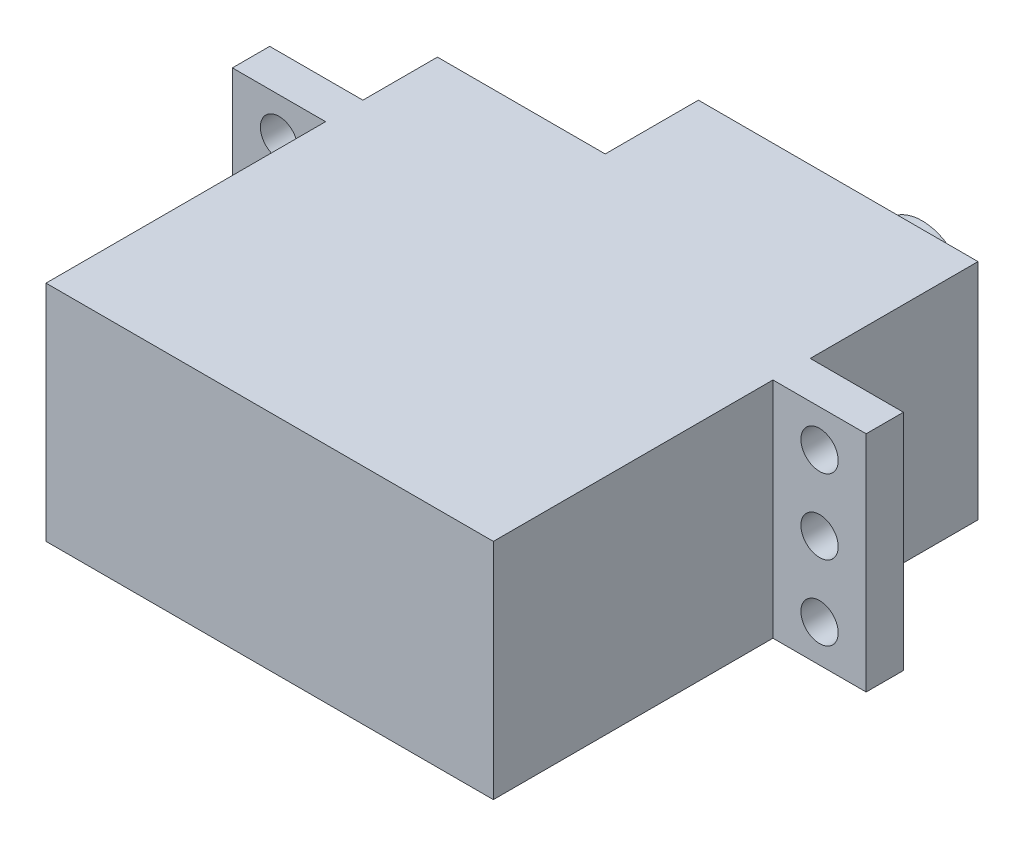
from build123d import *

# Parameters (mm, degrees)
SKETCH1_W           = 24
SKETCH1_H           = 12
BOSS_EXTRUDE1_DEPTH = 21
SKETCH2_W           = 34
SKETCH2_H           = 12
SKETCH2_R           = 1
BOSS_EXTRUDE2_DEPTH = 2
SKETCH3_W           = 15
SKETCH3_H           = 12
BOSS_EXTRUDE3_DEPTH = 5
SKETCH4_R           = 2.4
BOSS_EXTRUDE4_DEPTH = 4


with BuildPart() as part:
    # Sketch1 → Boss-Extrude1 (new body)
    with BuildSketch(Plane.XY):
        with Locations((12, -6)):
            Rectangle(SKETCH1_W, SKETCH1_H)
    extrude(amount=BOSS_EXTRUDE1_DEPTH)

    # Sketch2 → Boss-Extrude2 (add)
    with BuildSketch(Plane.XY.offset(6)):
        with Locations((12, -6)):
            Rectangle(SKETCH2_W, SKETCH2_H)
        with Locations((-2.5, -2)):
            Circle(SKETCH2_R, mode=Mode.SUBTRACT)
        with Locations((26.5, -2)):
            Circle(SKETCH2_R, mode=Mode.SUBTRACT)
        with Locations((26.5, -6)):
            Circle(SKETCH2_R, mode=Mode.SUBTRACT)
        with Locations((26.5, -10)):
            Circle(SKETCH2_R, mode=Mode.SUBTRACT)
        with Locations((-2.5, -6)):
            Circle(SKETCH2_R, mode=Mode.SUBTRACT)
        with Locations((-2.5, -10)):
            Circle(SKETCH2_R, mode=Mode.SUBTRACT)
    extrude(amount=-BOSS_EXTRUDE2_DEPTH)

    # Sketch3 → Boss-Extrude3 (add)
    with BuildSketch(Plane(origin=(0, 0, 0), x_dir=(-1, 0, 0), z_dir=(0, 0, -1))):
        with Locations((-16.5, -6)):
            Rectangle(SKETCH3_W, SKETCH3_H)
    extrude(amount=BOSS_EXTRUDE3_DEPTH)

    # Sketch4 → Boss-Extrude4 (add)
    with BuildSketch(Plane(origin=(0, 0, -5), x_dir=(-1, 0, 0), z_dir=(0, 0, -1))):
        with Locations((-17, -6)):
            Circle(SKETCH4_R)
    extrude(amount=BOSS_EXTRUDE4_DEPTH)


solid = part.part
